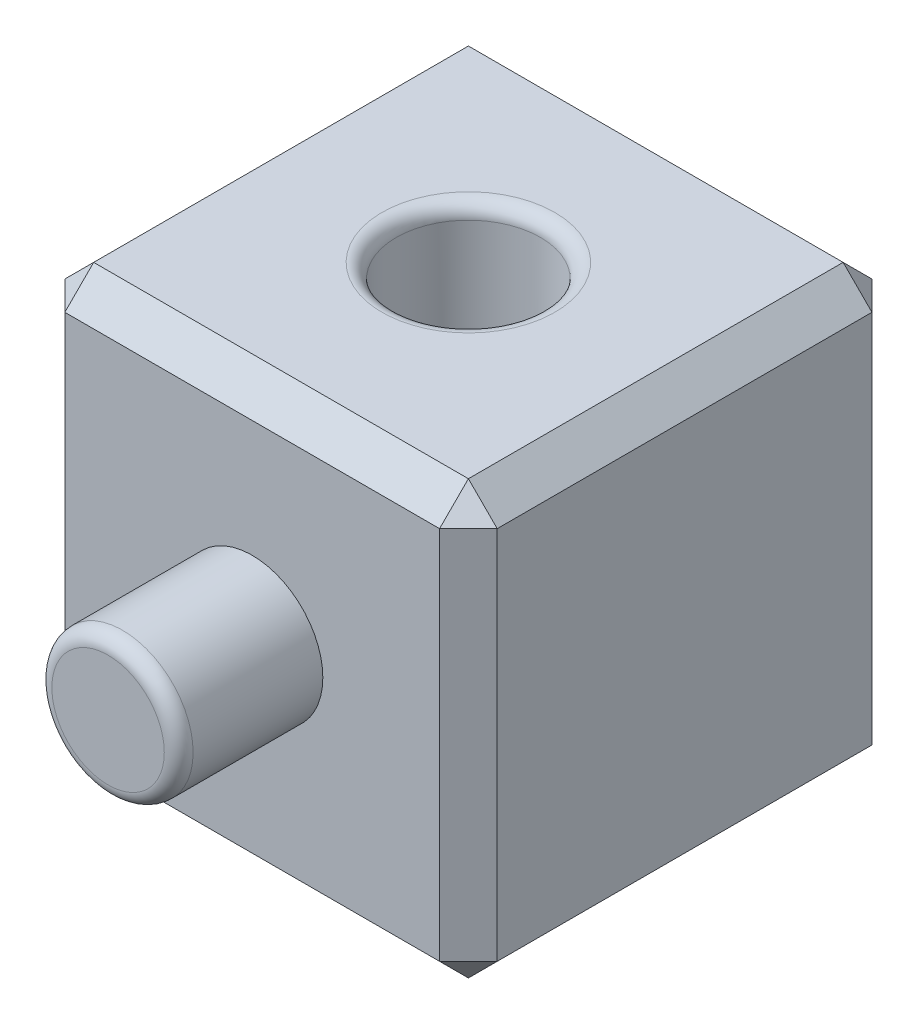
from build123d import *

# Parameters (mm, degrees)
SKETCH1_W           = 15
SKETCH1_H           = 15
BOSS_EXTRUDE1_DEPTH = 15
SKETCH2_R           = 2.45
BOSS_EXTRUDE2_DEPTH = 5
SKETCH7_R           = 2.5
CUT_EXTRUDE1_DEPTH  = 4
SKETCH13_R          = 2.5
CUT_EXTRUDE6_DEPTH  = 4
SKETCH16_R          = 2.5
CUT_EXTRUDE7_DEPTH  = 4
CHAMFER1_SIZE       = 1
FILLET1_R           = 0.5


with BuildPart() as part:
    # Sketch1 → Boss-Extrude1 (new body)
    with BuildSketch(Plane.XY):
        with Locations((7.5, 7.5)):
            Rectangle(SKETCH1_W, SKETCH1_H)
    extrude(amount=BOSS_EXTRUDE1_DEPTH)

    # Sketch2 → Boss-Extrude2 (add)
    with BuildSketch(Plane.XY.offset(15)):
        with Locations((7.5, 7.5)):
            Circle(SKETCH2_R)
    extrude(amount=BOSS_EXTRUDE2_DEPTH)

    # Sketch7 → Cut-Extrude1 (cut)
    with BuildSketch(Plane.ZY):
        with Locations((7.5, 7.5)):
            Circle(SKETCH7_R)
    extrude(amount=-CUT_EXTRUDE1_DEPTH, mode=Mode.SUBTRACT)

    # Sketch13 → Cut-Extrude6 (cut)
    with BuildSketch(Plane(origin=(0, 15, 0), x_dir=(1, 0, 0), z_dir=(0, 1, 0))):
        with Locations((7.5, -7.5)):
            Circle(SKETCH13_R)
    extrude(amount=-CUT_EXTRUDE6_DEPTH, mode=Mode.SUBTRACT)

    # Sketch16 → Cut-Extrude7 (cut)
    with BuildSketch(Plane(origin=(0, 0, 0), x_dir=(-1, 0, 0), z_dir=(0, 0, -1))):
        with Locations((-7.5, 7.5)):
            Circle(SKETCH16_R)
    extrude(amount=-CUT_EXTRUDE7_DEPTH, mode=Mode.SUBTRACT)

    # Chamfer1
    chamfer1_edges = [part.edges().sort_by_distance(p)[0] for p in [
        (7.5, 15, 15),
        (15, 15, 7.5),
        (15, 7.5, 15),
        (15, 0, 7.5),
        (7.5, 0, 15),
        (15, 7.5, 0),
        (7.5, 0, 0),
        (0, 7.5, 15),
        (0, 0, 7.5),
        (0, 15, 7.5),
        (7.5, 15, 0),
        (0, 7.5, 0),
    ]]
    chamfer(chamfer1_edges, length=CHAMFER1_SIZE)

    # Fillet1
    fillet1_edges = [part.edges().sort_by_distance(p)[0] for p in [
        (0, 7.5, 5),
        (5.05, 7.5, 20),
        (5, 15, 7.5),
        (10, 7.5, 0),
    ]]
    fillet(fillet1_edges, radius=FILLET1_R)


solid = part.part
